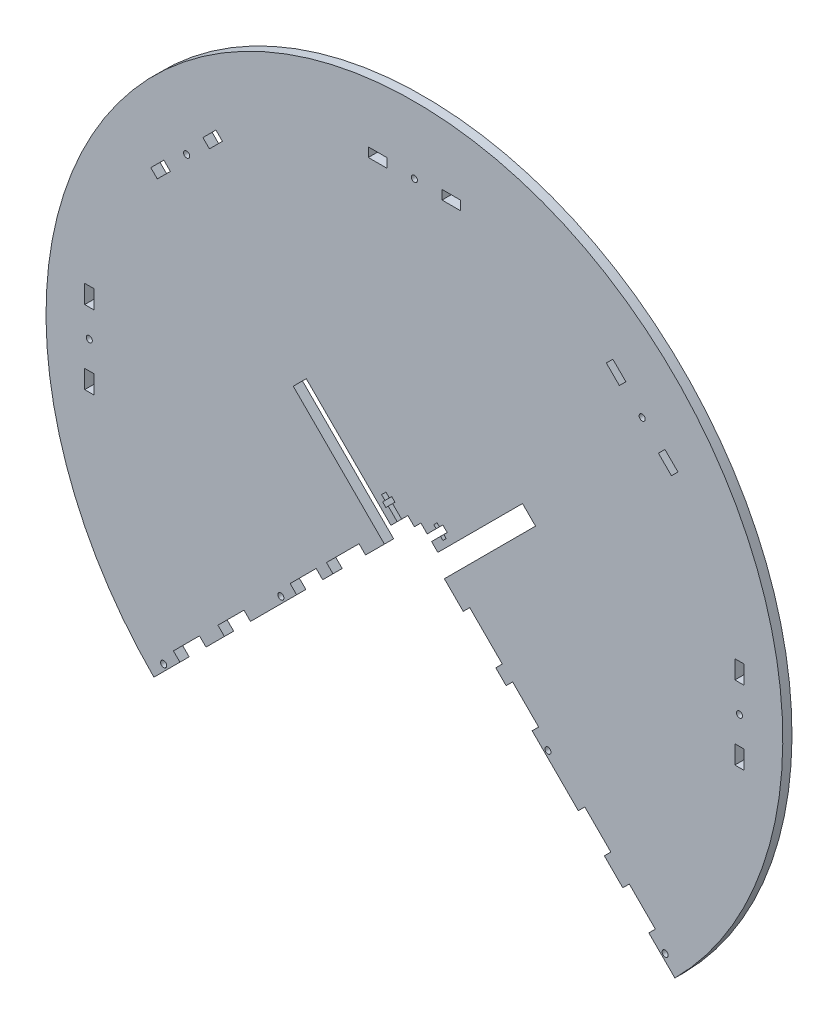
from build123d import *

# Parameters (mm, degrees)
SKETCH1_R           = 254
BOSS_EXTRUDE1_DEPTH = 6.35
CUT_EXTRUDE1_DEPTH  = 530.881249762
CUT_EXTRUDE2_DEPTH  = 466.964215177
SKETCH5_W           = 12.7
SKETCH5_H           = 6.35
SKETCH5_W_2         = 6.35
SKETCH5_H_2         = 12.7
CUT_EXTRUDE3_DEPTH  = 466.964215177
SKETCH6_R           = 2.0955
CUT_EXTRUDE4_DEPTH  = 466.964215177
SKETCH7_R           = 2.0955
CUT_EXTRUDE5_DEPTH  = 466.964215177
CUT_EXTRUDE6_DEPTH  = 466.964215177
CUT_EXTRUDE7_DEPTH  = 466.964215177


with BuildPart() as part:
    # Sketch1 → Boss-Extrude1 (new body)
    with BuildSketch(Plane.XY):
        with Locations((0, -210.99227558)):
            Circle(SKETCH1_R)
    extrude(amount=BOSS_EXTRUDE1_DEPTH)

    # Sketch3 → Cut-Extrude1 (cut, through all)
    with BuildSketch(Plane(origin=(0, 0, 0), x_dir=(-1, 0, 0), z_dir=(0, 0, -1))):
        with BuildLine():
            Line((179.605122421, -390.597398001), (0, -210.99227558))
            Line((0, -210.99227558), (-179.605122421, -390.597398001))
            ThreePointArc((-179.605122421, -390.597398001), (0, -464.99227558), (179.605122421, -390.597398001))
        make_face()
    extrude(amount=-CUT_EXTRUDE1_DEPTH, mode=Mode.SUBTRACT)

    # Sketch4 → Cut-Extrude2 (cut, through all)
    with BuildSketch(Plane.XY.offset(6.35)):
        Polygon((-161.644610179, -372.636885759), (-166.13473824, -368.146757699), (-148.174225998, -350.186245456), (-143.684097937, -354.676373517), align=None)
        Polygon((-130.96805527, -341.960330849), (-135.45818333, -337.470202789), (-117.497671088, -319.509690547), (-113.007543028, -323.999818607), align=None)
        Polygon((-81.190495591, -292.18277117), (-85.680623651, -287.69264311), (-67.720111409, -269.732130868), (-63.229983348, -274.222258928), align=None)
        Polygon((-56.126600757, -267.118876336), (-60.616728817, -262.628748276), (-38.166088515, -240.178107973), (-33.675960454, -244.668236034), align=None)
        Polygon((-11.689323621, -222.681599201), (-16.179451682, -218.19147114), (-4.490128061, -206.502147519), (0, -210.99227558), align=None)
    cut_extrude2 = extrude(amount=-CUT_EXTRUDE2_DEPTH, mode=Mode.SUBTRACT)

    # Mirror1: Cut-Extrude2 across plane
    add(cut_extrude2.mirror(Plane(origin=(0, 0, 0), x_dir=(0, 0, 1), z_dir=(1, 0, 0))), mode=Mode.SUBTRACT)

    # Sketch5 → Cut-Extrude3 (cut, through all)
    with BuildSketch(Plane.XY.offset(6.35)):
        Polygon((177.244959777, -91.888783362), (181.735087838, -87.398655301), (172.754831717, -78.41839918), (168.264703656, -82.908527241), align=None)
        with Locations((-25.4, -3.175)):
            Rectangle(SKETCH5_W, SKETCH5_H)
        with Locations((25.4, -3.175)):
            Rectangle(SKETCH5_W, SKETCH5_H)
        with Locations((-224.155, -236.39227558)):
            Rectangle(SKETCH5_W_2, SKETCH5_H_2)
        with Locations((-224.155, -185.59227558)):
            Rectangle(SKETCH5_W_2, SKETCH5_H_2)
        with Locations((224.155, -185.59227558)):
            Rectangle(SKETCH5_W_2, SKETCH5_H_2)
        with Locations((224.155, -236.39227558)):
            Rectangle(SKETCH5_W_2, SKETCH5_H_2)
        Polygon((141.323935293, -55.967758877), (145.814063353, -51.477630817), (136.833807232, -42.497374696), (132.343679172, -46.987502756), align=None)
        Polygon((-177.244959777, -91.888783362), (-181.735087838, -87.398655301), (-172.754831717, -78.41839918), (-168.264703656, -82.908527241), align=None)
        Polygon((-141.323935293, -55.967758877), (-145.814063353, -51.477630817), (-136.833807232, -42.497374696), (-132.343679172, -46.987502756), align=None)
    extrude(amount=-CUT_EXTRUDE3_DEPTH, mode=Mode.SUBTRACT)

    # Sketch6 → Cut-Extrude4 (cut, through all)
    with BuildSketch(Plane.XY.offset(6.35)):
        with Locations((-172.869930331, -379.37207785)):
            Circle(SKETCH6_R)
        with Locations((-92.047625241, -298.54977276)):
            Circle(SKETCH6_R)
    cut_extrude4 = extrude(amount=-CUT_EXTRUDE4_DEPTH, mode=Mode.SUBTRACT)

    # Mirror2: Cut-Extrude4 across plane
    add(cut_extrude4.mirror(Plane(origin=(0, 0, 0), x_dir=(0, 0, 1), z_dir=(1, 0, 0))), mode=Mode.SUBTRACT)

    # Sketch7 → Cut-Extrude5 (cut, through all)
    with BuildSketch(Plane.XY.offset(6.35)):
        with Locations((-224.155, -210.99227558)):
            Circle(SKETCH7_R)
        with Locations((-157.039383505, -67.193079029)):
            Circle(SKETCH7_R)
        with Locations((0, -3.175)):
            Circle(SKETCH7_R)
        with Locations((157.039383505, -67.193079029)):
            Circle(SKETCH7_R)
        with Locations((224.155, -210.99227558)):
            Circle(SKETCH7_R)
    extrude(amount=-CUT_EXTRUDE5_DEPTH, mode=Mode.SUBTRACT)

    # Sketch8 → Cut-Extrude6 (cut, through all)
    with BuildSketch(Plane.XY.offset(6.35)):
        Polygon((-20.669579742, -231.661855322), (-11.689323621, -222.681599201), (-74.551116468, -159.819806353), (-83.53137259, -168.800062475), align=None)
    cut_extrude6 = extrude(amount=-CUT_EXTRUDE6_DEPTH, mode=Mode.SUBTRACT)

    # Mirror3: Cut-Extrude6 across plane
    add(cut_extrude6.mirror(Plane(origin=(0, 0, 0), x_dir=(0, 0, 1), z_dir=(1, 0, 0))), mode=Mode.SUBTRACT)

    # Sketch9 → Cut-Extrude7 (cut, through all)
    with BuildSketch(Plane.XY.offset(6.35)):
        Polygon((-11.843472899, -213.855492358), (-8.826106843, -210.838126301), (-15.022483566, -204.641749578), (-13.388076952, -203.007342964), (-15.633140982, -200.762278934), (-17.267547597, -202.396685548), (-19.602414188, -200.061818956), (-22.619780245, -203.079185013), (-20.284913653, -205.414051604), (-21.919320267, -207.048458218), (-19.674256237, -209.293522249), (-18.039849623, -207.659115635), align=None)
    cut_extrude7 = extrude(amount=-CUT_EXTRUDE7_DEPTH, mode=Mode.SUBTRACT)

    # Mirror4: Cut-Extrude7 across plane
    add(cut_extrude7.mirror(Plane(origin=(0, 0, 0), x_dir=(0, 0, 1), z_dir=(1, 0, 0))), mode=Mode.SUBTRACT)


solid = part.part
